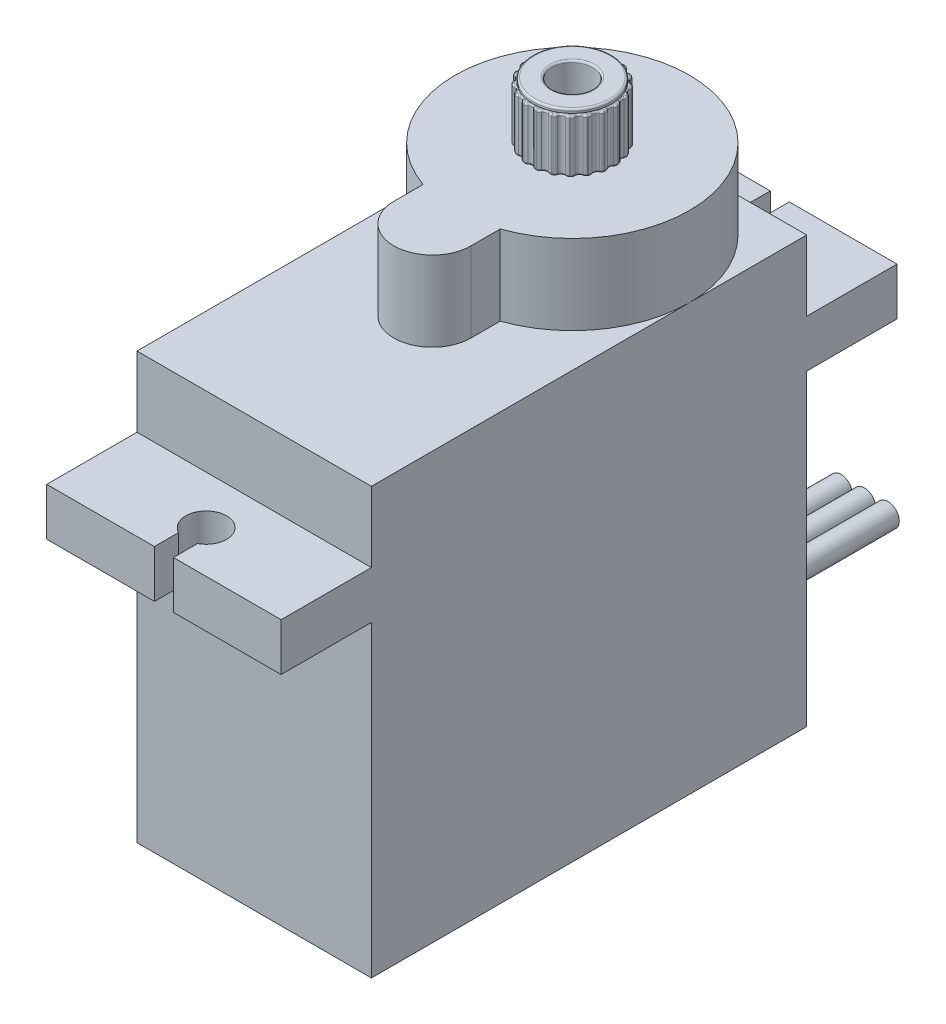
from build123d import *

# Parameters (mm, degrees)
SKETCH1_W               = 12.33
SKETCH1_H               = 22.9
BOSS_EXTRUDE1_DEPTH     = 22.4
BOSS_EXTRUDE2_START     = -3.7
SKETCH2_W               = 12.33
SKETCH2_H               = 32.4
BOSS_EXTRUDE2_DEPTH     = 2.5
CUT_EXTRUDE1_DEPTH      = 29.323262965
BOSS_EXTRUDE3_DEPTH     = 4.2
SKETCH5_R               = 0.6
BOSS_EXTRUDE4_DEPTH     = 9.2
BOSS_EXTRUDE4_2_DEPTH   = 9.2
BOSS_EXTRUDE4_3_DEPTH   = 9.2
SKETCH6_R               = 2.25
BOSS_EXTRUDE5_DEPTH     = 3
SKETCH7_R               = 0.234579994
CUT_EXTRUDE2_DEPTH      = 3
CIRPATTERN1_COUNT       = 21
SKETCH8_R               = 3.063872577
SKETCH8_R_2             = 2.063872577
CUT_EXTRUDE_THIN1_DEPTH = 0.2
SKETCH9_R               = 1.06589143
CUT_EXTRUDE3_DEPTH      = 2.2
FILLET1_R               = 0.2
FILLET2_R               = 0.1
FILLET3_R               = 0.1
FILLET4_R               = 0.1


with BuildPart() as part:
    # Sketch1 → Boss-Extrude1 (new body)
    with BuildSketch(Plane(origin=(0, 0, 0), x_dir=(1, 0, 0), z_dir=(0, 1, 0))):
        Rectangle(SKETCH1_W, SKETCH1_H)
    extrude(amount=BOSS_EXTRUDE1_DEPTH)

    # Sketch2 → Boss-Extrude2 (add)
    with BuildSketch(Plane(origin=(0, 22.4, 0), x_dir=(1, 0, 0), z_dir=(0, 1, 0)).offset(BOSS_EXTRUDE2_START)):
        Rectangle(SKETCH2_W, SKETCH2_H)
    extrude(amount=-BOSS_EXTRUDE2_DEPTH)

    # Sketch3 → Cut-Extrude1 (cut, through all)
    with BuildSketch(Plane(origin=(0, 0, 0), x_dir=(1, 0, 0), z_dir=(0, 1, 0))):
        with BuildLine():
            Line((0.5, 17.47195578), (-0.5, 17.47195578))
            Line((-0.5, 17.47195578), (-0.5, 14.92804422))
            ThreePointArc((-0.5, 14.92804422), (0, 12.901400905), (0.5, 14.92804422))
            Line((0.5, 14.92804422), (0.5, 17.47195578))
        make_face()
    cut_extrude1 = extrude(amount=CUT_EXTRUDE1_DEPTH, mode=Mode.SUBTRACT)

    # Mirror1: Cut-Extrude1 across plane
    add(cut_extrude1.mirror(Plane.XY), mode=Mode.SUBTRACT)

    # Sketch4 → Boss-Extrude3 (add)
    with BuildSketch(Plane(origin=(0, 22.4, 0), x_dir=(1, 0, 0), z_dir=(0, 1, 0))):
        with BuildLine():
            Line((-2.027992208, -0.536895963), (-2.027992208, -2.076130587))
            ThreePointArc((-2.027992208, -2.076130587), (0, -4.104122795), (2.027992208, -2.076130587))
            Line((2.027992208, -2.076130587), (2.027992208, -0.536895963))
            ThreePointArc((2.027992208, -0.536895963), (0, 11.45), (-2.027992208, -0.536895963))
        make_face()
    extrude(amount=BOSS_EXTRUDE3_DEPTH)


with BuildPart() as body_2:
    # Sketch5 → Boss-Extrude4 (new body)
    with BuildSketch(Plane(origin=(0, 0, -11.45), x_dir=(-1, 0, 0), z_dir=(0, 0, -1))):
        with Locations((0, 2.598120624)):
            Circle(SKETCH5_R)
    extrude(amount=BOSS_EXTRUDE4_DEPTH)


with BuildPart() as body_3:
    # Sketch5 → Boss-Extrude4 2 (new body)
    with BuildSketch(Plane(origin=(0, 0, -11.45), x_dir=(-1, 0, 0), z_dir=(0, 0, -1))):
        with Locations((1.235, 2.598120624)):
            Circle(SKETCH5_R)
    extrude(amount=BOSS_EXTRUDE4_2_DEPTH)


with BuildPart() as body_4:
    # Sketch5 → Boss-Extrude4 3 (new body)
    with BuildSketch(Plane(origin=(0, 0, -11.45), x_dir=(-1, 0, 0), z_dir=(0, 0, -1))):
        with Locations((-1.235, 2.598120624)):
            Circle(SKETCH5_R)
    extrude(amount=BOSS_EXTRUDE4_3_DEPTH)


with BuildPart() as body_5:
    # Sketch6 → Boss-Extrude5 (new body)
    with BuildSketch(Plane(origin=(0, 26.6, 0), x_dir=(1, 0, 0), z_dir=(0, 1, 0))):
        with Locations((0, 5.285)):
            Circle(SKETCH6_R)
    extrude(amount=BOSS_EXTRUDE5_DEPTH)

    # Sketch7 → Cut-Extrude2 (cut)
    with BuildSketch(Plane(origin=(0, 26.6, 0), x_dir=(1, 0, 0), z_dir=(0, 1, 0))):
        with Locations((0, 2.924646397)):
            Circle(SKETCH7_R)
    cut_extrude2 = extrude(amount=CUT_EXTRUDE2_DEPTH, mode=Mode.SUBTRACT)

    # CirPattern1: Cut-Extrude2 ×21 about axis
    cirpattern1_axis = Axis((0, 29.6, -5.285), (0, -1, 0))
    for i in range(1, CIRPATTERN1_COUNT):
        add(cut_extrude2.rotate(cirpattern1_axis, i * 360 / CIRPATTERN1_COUNT), mode=Mode.SUBTRACT)

    # Sketch8 → Cut-Extrude-Thin1 (cut)
    with BuildSketch(Plane(origin=(0, 29.6, 0), x_dir=(1, 0, 0), z_dir=(0, 1, 0))):
        with Locations((0, 5.285)):
            Circle(SKETCH8_R)
        with Locations((0, 5.285)):
            Circle(SKETCH8_R_2, mode=Mode.SUBTRACT)
    extrude(amount=-CUT_EXTRUDE_THIN1_DEPTH, mode=Mode.SUBTRACT)

    # Sketch9 → Cut-Extrude3 (cut)
    with BuildSketch(Plane(origin=(0, 29.6, 0), x_dir=(1, 0, 0), z_dir=(0, 1, 0))):
        with Locations((0, 5.285)):
            Circle(SKETCH9_R)
    extrude(amount=-CUT_EXTRUDE3_DEPTH, mode=Mode.SUBTRACT)

    # Fillet1
    fillet1_edges = [body_5.edges().sort_by_distance(p)[0] for p in [
        (-0.533638398, 28, -7.470801926),
        (-0.134346087, 28, -7.530985559),
        (0.134346087, 28, -7.530985559),
        (0.533638398, 28, -7.470801926),
        (0.790393332, 28, -7.391603518),
        (1.154206769, 28, -7.2164002),
        (1.376210661, 28, -7.06504051),
        (1.672218804, 28, -6.790385091),
        (1.839745634, 28, -6.580313091),
        (2.041646859, 28, -6.23060991),
        (2.139811133, 28, -5.980491419),
        (2.229665632, 28, -5.586813139),
        (2.249745023, 28, -5.318872283),
        (2.219568828, 28, -4.916198946),
        (2.159779195, 28, -4.654243446),
        (2.012253594, 28, -4.278354345),
        (1.877907507, 28, -4.045660097),
        (1.626140797, 28, -3.729954628),
        (1.429175496, 28, -3.547197537),
        (0.853454971, 28, -3.203146352),
        (0.467592329, 28, -3.08412349),
        (0.201901226, 28, -3.044076999),
        (-0.201901226, 28, -3.044076999),
        (-0.467592329, 28, -3.08412349),
        (-0.853454971, 28, -3.203146352),
        (-1.095538254, 28, -3.319727516),
        (-1.429175496, 28, -3.547197537),
        (-1.626140797, 28, -3.729954628),
        (-1.877907507, 28, -4.045660097),
        (-2.012253594, 28, -4.278354345),
        (-2.159779195, 28, -4.654243446),
        (-2.219568828, 28, -4.916198946),
        (-2.249745023, 28, -5.318872283),
        (-2.229665632, 28, -5.586813139),
        (-2.139811133, 28, -5.980491419),
        (-2.041646859, 28, -6.23060991),
        (-1.839745634, 28, -6.580313091),
        (-1.672218804, 28, -6.790385091),
        (-1.376210661, 28, -7.06504051),
        (-1.154206769, 28, -7.2164002),
        (-0.790393332, 28, -7.391603518),
        (1.095538254, 28, -3.319727516),
    ]]
    fillet(fillet1_edges, radius=FILLET1_R)

    # Fillet2
    fillet2_edges = [body_5.edges().sort_by_distance(p)[0] for p in [
        (0.226568903, 29.4, -3.062677122),
        (0.335345099, 29.4, -3.060130641),
        (0.438538086, 29.4, -3.094626335),
        (0.626582771, 29.4, -3.253668548),
        (0.87154425, 29.4, -3.228191048),
        (0.976238413, 29.4, -3.257820047),
        (1.06467904, 29.4, -3.321199861),
        (1.197490913, 29.4, -3.528603419),
        (1.439079065, 29.4, -3.576461476),
        (1.53038866, 29.4, -3.635633288),
        (1.59621859, 29.4, -3.722265648),
        (1.661996732, 29.4, -3.959601834),
        (1.878745391, 29.4, -4.07654305),
        (1.948557159, 29.4, -4.16),
        (1.985927114, 29.4, -4.262187239),
        (1.978826848, 29.4, -4.508367692),
        (2.151476944, 29.4, -4.684001327),
        (2.193587802, 29.4, -4.784327899),
        (2.199177298, 29.4, -4.892990233),
        (2.119829515, 29.4, -5.126140739),
        (2.233040328, 29.4, -5.344860973),
        (2.243708544, 29.4, -5.453142711),
        (2.217020928, 29.4, -5.558625015),
        (2.072476026, 29.4, -5.758029129),
        (2.11618828, 29.4, -6.00040171),
        (2.094465934, 29.4, -6.107017305),
        (2.037872519, 29.4, -6.199947014),
        (1.840973948, 29.4, -6.347886804),
        (1.811303617, 29.4, -6.592375865),
        (1.759120836, 29.4, -6.687852054),
        (1.677650195, 29.4, -6.759971955),
        (1.445893255, 29.4, -6.843302323),
        (1.345476678, 29.4, -7.068183937),
        (1.267470131, 29.4, -7.144037242),
        (1.168361288, 29.4, -7.188939165),
        (0.922338602, 29.4, -7.200255842),
        (0.760098232, 29.4, -7.385548291),
        (0.663199142, 29.4, -7.435038813),
        (0.555258353, 29.4, -7.448733025),
        (0.316830116, 29.4, -7.387030474),
        (0.107181723, 29.4, -7.516269711),
        (0, 29.4, -7.535),
        (-0.107181723, 29.4, -7.516269711),
        (-0.316830116, 29.4, -7.387030474),
        (-0.555258353, 29.4, -7.448733025),
        (-0.663199142, 29.4, -7.435038813),
        (-0.760098232, 29.4, -7.385548291),
        (-0.922338602, 29.4, -7.200255842),
        (-1.168361288, 29.4, -7.188939165),
        (-1.267470131, 29.4, -7.144037242),
        (-1.345476678, 29.4, -7.068183937),
        (-1.445893255, 29.4, -6.843302323),
        (-1.677650195, 29.4, -6.759971955),
        (-1.759120836, 29.4, -6.687852054),
        (-1.811303617, 29.4, -6.592375865),
        (-1.840973948, 29.4, -6.347886804),
        (-2.037872519, 29.4, -6.199947014),
        (-2.094465934, 29.4, -6.107017305),
        (-2.11618828, 29.4, -6.00040171),
        (-2.072476026, 29.4, -5.758029129),
        (-2.217020928, 29.4, -5.558625015),
        (-2.243708544, 29.4, -5.453142711),
        (-2.233040328, 29.4, -5.344860973),
        (-2.119829515, 29.4, -5.126140739),
        (-2.199177298, 29.4, -4.892990233),
        (-2.193587802, 29.4, -4.784327899),
        (-2.151476944, 29.4, -4.684001327),
        (-1.978826848, 29.4, -4.508367692),
        (-1.985927114, 29.4, -4.262187239),
        (-1.948557159, 29.4, -4.16),
        (-1.878745391, 29.4, -4.07654305),
        (-1.661996732, 29.4, -3.959601834),
        (-1.59621859, 29.4, -3.722265648),
        (-1.53038866, 29.4, -3.635633288),
        (-1.439079065, 29.4, -3.576461476),
        (-1.197490913, 29.4, -3.528603419),
        (-1.06467904, 29.4, -3.321199861),
        (-0.976238413, 29.4, -3.257820047),
        (-0.87154425, 29.4, -3.228191048),
        (-0.626582771, 29.4, -3.253668548),
        (-0.438538086, 29.4, -3.094626335),
        (-0.335345099, 29.4, -3.060130641),
        (-0.226568903, 29.4, -3.062677122),
        (0, 29.4, -3.159226391),
    ]]
    fillet(fillet2_edges, radius=FILLET2_R)

    # Fillet3
    fillet3_edges = [body_5.edges().sort_by_distance(p)[0] for p in [
        (1.439079065, 26.6, -3.576461476),
        (1.53038866, 26.6, -3.635633288),
        (1.59621859, 26.6, -3.722265648),
        (1.661996732, 26.6, -3.959601834),
        (1.878745391, 26.6, -4.07654305),
        (1.948557159, 26.6, -4.16),
        (1.985927114, 26.6, -4.262187239),
        (1.978826848, 26.6, -4.508367692),
        (2.151476944, 26.6, -4.684001327),
        (2.193587802, 26.6, -4.784327899),
        (2.199177298, 26.6, -4.892990233),
        (2.119829515, 26.6, -5.126140739),
        (2.233040328, 26.6, -5.344860973),
        (2.243708544, 26.6, -5.453142711),
        (2.217020928, 26.6, -5.558625015),
        (2.072476026, 26.6, -5.758029129),
        (2.11618828, 26.6, -6.00040171),
        (2.094465934, 26.6, -6.107017305),
        (2.037872519, 26.6, -6.199947014),
        (1.840973948, 26.6, -6.347886804),
        (1.811303617, 26.6, -6.592375865),
        (1.759120836, 26.6, -6.687852054),
        (1.677650195, 26.6, -6.759971955),
        (1.445893255, 26.6, -6.843302323),
        (1.345476678, 26.6, -7.068183937),
        (1.267470131, 26.6, -7.144037242),
        (1.168361288, 26.6, -7.188939165),
        (0.922338602, 26.6, -7.200255842),
        (0.760098232, 26.6, -7.385548291),
        (0.663199142, 26.6, -7.435038813),
        (0.555258353, 26.6, -7.448733025),
        (0.316830116, 26.6, -7.387030474),
        (0.107181723, 26.6, -7.516269711),
        (0, 26.6, -7.535),
        (-0.107181723, 26.6, -7.516269711),
        (-0.316830116, 26.6, -7.387030474),
        (-0.555258353, 26.6, -7.448733025),
        (-0.663199142, 26.6, -7.435038813),
        (-0.760098232, 26.6, -7.385548291),
        (-0.922338602, 26.6, -7.200255842),
        (-1.168361288, 26.6, -7.188939165),
        (-1.267470131, 26.6, -7.144037242),
        (-1.345476678, 26.6, -7.068183937),
        (-1.445893255, 26.6, -6.843302323),
        (-1.677650195, 26.6, -6.759971955),
        (-1.759120836, 26.6, -6.687852054),
        (-1.811303617, 26.6, -6.592375865),
        (-1.840973948, 26.6, -6.347886804),
        (-2.037872519, 26.6, -6.199947014),
        (-2.094465934, 26.6, -6.107017305),
        (-2.11618828, 26.6, -6.00040171),
        (-2.072476026, 26.6, -5.758029129),
        (-2.217020928, 26.6, -5.558625015),
        (-2.243708544, 26.6, -5.453142711),
        (-2.233040328, 26.6, -5.344860973),
        (-2.119829515, 26.6, -5.126140739),
        (-2.199177298, 26.6, -4.892990233),
        (-2.193587802, 26.6, -4.784327899),
        (-2.151476944, 26.6, -4.684001327),
        (-1.978826848, 26.6, -4.508367692),
        (-1.985927114, 26.6, -4.262187239),
        (-1.948557159, 26.6, -4.16),
        (-1.878745391, 26.6, -4.07654305),
        (-1.661996732, 26.6, -3.959601834),
        (-1.59621859, 26.6, -3.722265648),
        (-1.53038866, 26.6, -3.635633288),
        (-1.439079065, 26.6, -3.576461476),
        (-1.197490913, 26.6, -3.528603419),
        (-1.06467904, 26.6, -3.321199861),
        (-0.976238413, 26.6, -3.257820047),
        (-0.87154425, 26.6, -3.228191048),
        (-0.626582771, 26.6, -3.253668548),
        (-0.438538086, 26.6, -3.094626335),
        (-0.335345099, 26.6, -3.060130641),
        (-0.226568903, 26.6, -3.062677122),
        (0, 26.6, -3.159226391),
        (0.226568903, 26.6, -3.062677122),
        (0.335345099, 26.6, -3.060130641),
        (0.438538086, 26.6, -3.094626335),
        (0.626582771, 26.6, -3.253668548),
        (0.87154425, 26.6, -3.228191048),
        (0.976238413, 26.6, -3.257820047),
        (1.06467904, 26.6, -3.321199861),
        (1.197490913, 26.6, -3.528603419),
    ]]
    fillet(fillet3_edges, radius=FILLET3_R)

    # Fillet4
    fillet4_edges = [body_5.edges().sort_by_distance(p)[0] for p in [
        (-2.063872577, 29.6, -5.285),
        (-1.06589143, 29.6, -5.285),
    ]]
    fillet(fillet4_edges, radius=FILLET4_R)


solid = Compound([part.part, body_2.part, body_3.part, body_4.part, body_5.part])
